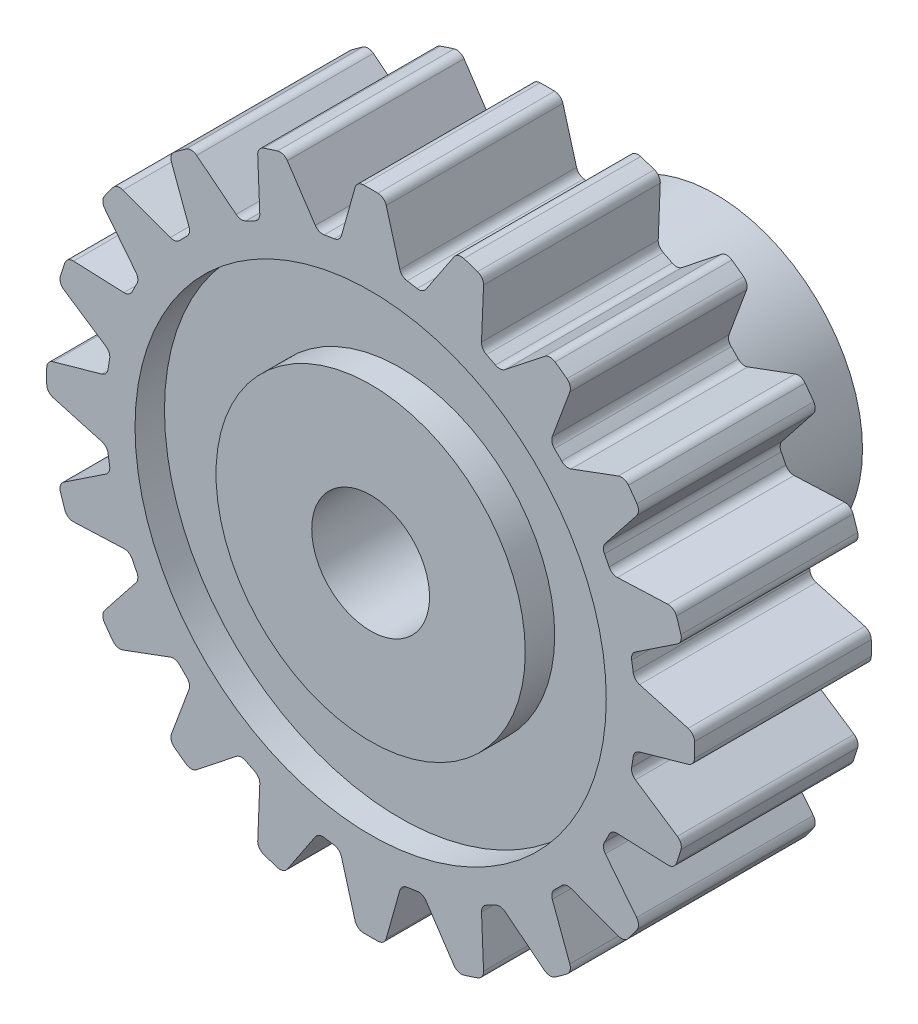
from build123d import *

# Parameters (mm, degrees)
SKETCH1_R                       = 9
BODY_DEPTH                      = 6
TOOTH_DEPTH                     = 6
TOOTH_FILLET_R                  = 0.3
TOOTH_PATTERN_COUNT             = 20
TOOTH_FILLET_OF_TOOTH_PATTERN_R = 0.3
SKETCH3_R                       = 8
SKETCH3_R_2                     = 5.25
RESSES1_DEPTH                   = 1
RESSES2_START                   = -1
SKETCH4_R                       = 8
SKETCH4_R_2                     = 5.25
RESSES2_DEPTH                   = 1
SKETCH5_R                       = 5
BRASS_BOSS_DEPTH                = 5.7
SKETCH6_R                       = 2
BORE_DEPTH                      = 20.465096969
SKETCH7_R                       = 1
GRUB_SCREW_DEPTH                = 20.465096969


with BuildPart() as part:
    # Sketch1 → Body (new body)
    with BuildSketch(Plane.XY):
        Circle(SKETCH1_R)
    extrude(amount=-BODY_DEPTH)

    # Sketch2 → Tooth (add)
    with BuildSketch(Plane.XY):
        with BuildLine():
            Line((-0.755, 9.971458018), (-1.044579423, 8.939175232))
            ThreePointArc((-1.044579423, 8.939175232), (0, 9), (1.044579423, 8.939175232))
            Line((1.044579423, 8.939175232), (0.755, 9.971458018))
            Line((0.755, 9.971458018), (0.469279316, 10.989985301))
            ThreePointArc((0.469279316, 10.989985301), (0, 11), (-0.469279316, 10.989985301))
            Line((-0.469279316, 10.989985301), (-0.755, 9.971458018))
        make_face()
    tooth = extrude(amount=-TOOTH_DEPTH)

    # Tooth Fillet
    tooth_fillet_edges = [part.edges().sort_by_distance(p)[0] for p in [
        (-0.469279316, 10.989985301, -3),
        (-1.044579423, 8.939175232, -3),
        (0.469279316, 10.989985301, -3),
        (1.044579423, 8.939175232, -3),
    ]]
    fillet(tooth_fillet_edges, radius=TOOTH_FILLET_R)

    # Tooth Pattern: Tooth ×20 about axis
    tooth_pattern_axis = Axis((0, 0, 0), (0, 0, 1))
    for i in range(1, TOOTH_PATTERN_COUNT):
        add(tooth.rotate(tooth_pattern_axis, i * 360 / TOOTH_PATTERN_COUNT))

    # Tooth Fillet of Tooth Pattern
    tooth_fillet_of_tooth_pattern_edges = [part.edges().sort_by_distance(p)[0] for p in [
        (-3.842403378, 10.307081851, -3),
        (-3.75581113, 8.178868061, -3),
        (-2.949781074, 10.597112419, -3),
        (-1.768902995, 8.824453648, -3),
        (-6.839406225, 8.615249415, -3),
        (-6.099397874, 6.617956299, -3),
        (-6.080096341, 9.166920338, -3),
        (-4.409232864, 7.845933058, -3),
        (-9.166920338, 6.080096341, -3),
        (-7.845933058, 4.409232864, -3),
        (-8.615249415, 6.839406225, -3),
        (-6.617956299, 6.099397874, -3),
        (-10.597112419, 2.949781074, -3),
        (-8.824453648, 1.768902995, -3),
        (-10.307081851, 3.842403378, -3),
        (-8.178868061, 3.75581113, -3),
        (-10.989985301, -0.469279316, -3),
        (-8.939175232, -1.044579423, -3),
        (-10.989985301, 0.469279316, -3),
        (-8.939175232, 1.044579423, -3),
        (-10.307081851, -3.842403378, -3),
        (-8.178868061, -3.75581113, -3),
        (-10.597112419, -2.949781074, -3),
        (-8.824453648, -1.768902995, -3),
        (-8.615249415, -6.839406225, -3),
        (-6.617956299, -6.099397874, -3),
        (-9.166920338, -6.080096341, -3),
        (-7.845933058, -4.409232864, -3),
        (-6.080096341, -9.166920338, -3),
        (-4.409232864, -7.845933058, -3),
        (-6.839406225, -8.615249415, -3),
        (-6.099397874, -6.617956299, -3),
        (-2.949781074, -10.597112419, -3),
        (-1.768902995, -8.824453648, -3),
        (-3.842403378, -10.307081851, -3),
        (-3.75581113, -8.178868061, -3),
        (0.469279316, -10.989985301, -3),
        (1.044579423, -8.939175232, -3),
        (-0.469279316, -10.989985301, -3),
        (-1.044579423, -8.939175232, -3),
        (3.842403378, -10.307081851, -3),
        (3.75581113, -8.178868061, -3),
        (2.949781074, -10.597112419, -3),
        (1.768902995, -8.824453648, -3),
        (6.839406225, -8.615249415, -3),
        (6.099397874, -6.617956299, -3),
        (6.080096341, -9.166920338, -3),
        (4.409232864, -7.845933058, -3),
        (9.166920338, -6.080096341, -3),
        (7.845933058, -4.409232864, -3),
        (8.615249415, -6.839406225, -3),
        (6.617956299, -6.099397874, -3),
        (10.597112419, -2.949781074, -3),
        (8.824453648, -1.768902995, -3),
        (10.307081851, -3.842403378, -3),
        (8.178868061, -3.75581113, -3),
        (10.989985301, 0.469279316, -3),
        (8.939175232, 1.044579423, -3),
        (10.989985301, -0.469279316, -3),
        (8.939175232, -1.044579423, -3),
        (10.307081851, 3.842403378, -3),
        (8.178868061, 3.75581113, -3),
        (10.597112419, 2.949781074, -3),
        (8.824453648, 1.768902995, -3),
        (8.615249415, 6.839406225, -3),
        (6.617956299, 6.099397874, -3),
        (9.166920338, 6.080096341, -3),
        (7.845933058, 4.409232864, -3),
        (6.080096341, 9.166920338, -3),
        (4.409232864, 7.845933058, -3),
        (6.839406225, 8.615249415, -3),
        (6.099397874, 6.617956299, -3),
        (2.949781074, 10.597112419, -3),
        (1.768902995, 8.824453648, -3),
        (3.842403378, 10.307081851, -3),
        (3.75581113, 8.178868061, -3),
    ]]
    fillet(tooth_fillet_of_tooth_pattern_edges, radius=TOOTH_FILLET_OF_TOOTH_PATTERN_R)

    # Sketch3 → Resses1 (cut)
    with BuildSketch(Plane.XY):
        Circle(SKETCH3_R)
        Circle(SKETCH3_R_2, mode=Mode.SUBTRACT)
    extrude(amount=-RESSES1_DEPTH, mode=Mode.SUBTRACT)

    # Sketch4 → Resses2 (cut)
    with BuildSketch(Plane(origin=(0, 0, -6), x_dir=(-1, 0, 0), z_dir=(0, 0, -1)).offset(RESSES2_START)):
        Circle(SKETCH4_R)
        Circle(SKETCH4_R_2, mode=Mode.SUBTRACT)
    extrude(amount=RESSES2_DEPTH, mode=Mode.SUBTRACT)

    # Sketch5 → Brass boss (add)
    with BuildSketch(Plane(origin=(0, 0, -6), x_dir=(-1, 0, 0), z_dir=(0, 0, -1))):
        Circle(SKETCH5_R)
    extrude(amount=BRASS_BOSS_DEPTH)

    # Sketch6 → Bore (cut, through all)
    with BuildSketch(Plane(origin=(0, 0, -11.7), x_dir=(-1, 0, 0), z_dir=(0, 0, -1))):
        Circle(SKETCH6_R)
    extrude(amount=-BORE_DEPTH, mode=Mode.SUBTRACT)

    # Sketch7 → Grub screw (cut, through all)
    with BuildSketch(Plane(origin=(0, 0, 0), x_dir=(1, 0, 0), z_dir=(0, 1, 0))):
        with Locations((0, 8.862584309)):
            Circle(SKETCH7_R)
    extrude(amount=-GRUB_SCREW_DEPTH, mode=Mode.SUBTRACT)


solid = part.part
